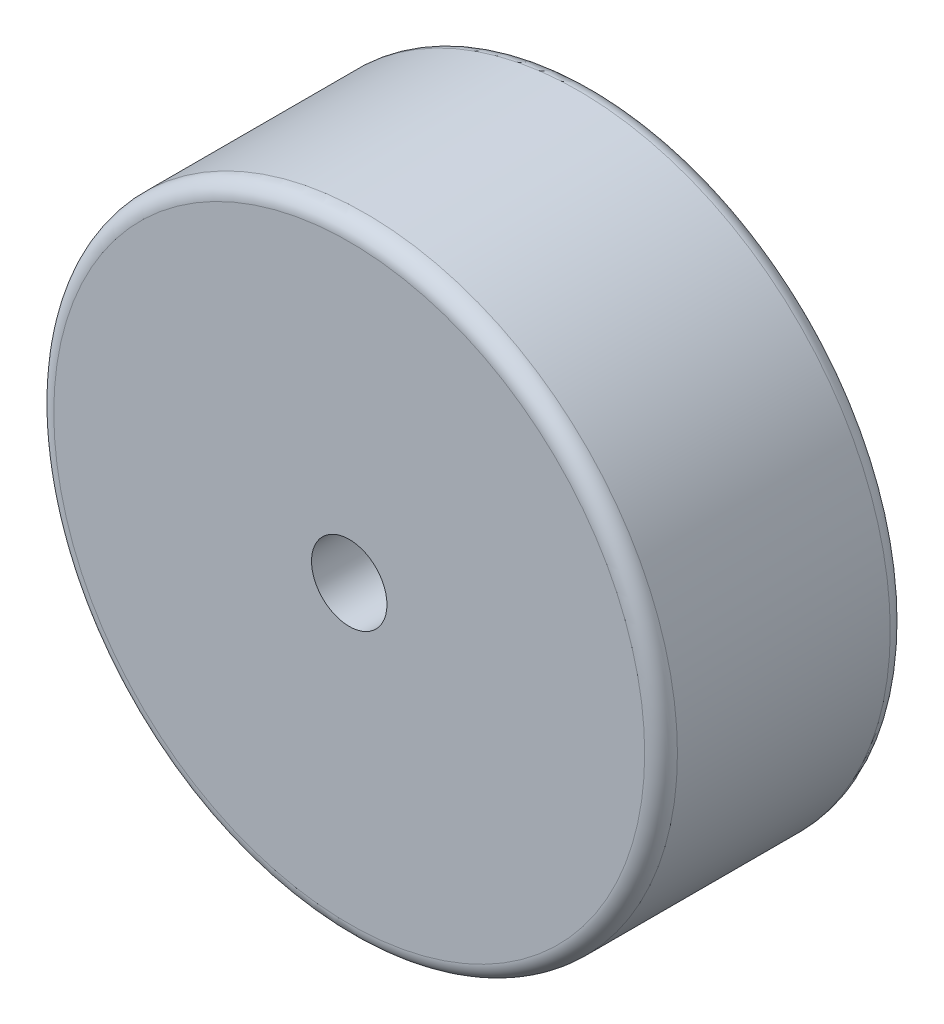
from build123d import *

# Parameters (mm, degrees)
BODY_SKETCH_R    = 19.05
WHEEL_BODY_DEPTH = 7.5
FILLET_WHEEL_R   = 1
HOLE_SKETCH_R    = 2.305
HOLE_SHAFT_DEPTH = 15


with BuildPart() as part:
    # body sketch → wheel body (new, symmetric)
    with BuildSketch(Plane.XY):
        Circle(BODY_SKETCH_R)
    extrude(amount=WHEEL_BODY_DEPTH, both=True)

    # fillet wheel
    fillet_wheel_edges = [part.edges().sort_by_distance(p)[0] for p in [
        (-19.05, 0, -7.5),
        (-19.05, 0, 7.5),
    ]]
    fillet(fillet_wheel_edges, radius=FILLET_WHEEL_R)

    # hole sketch → hole shaft (cut)
    with BuildSketch(Plane.XY.offset(7.5)):
        Circle(HOLE_SKETCH_R)
    extrude(amount=-HOLE_SHAFT_DEPTH, mode=Mode.SUBTRACT)


solid = part.part
